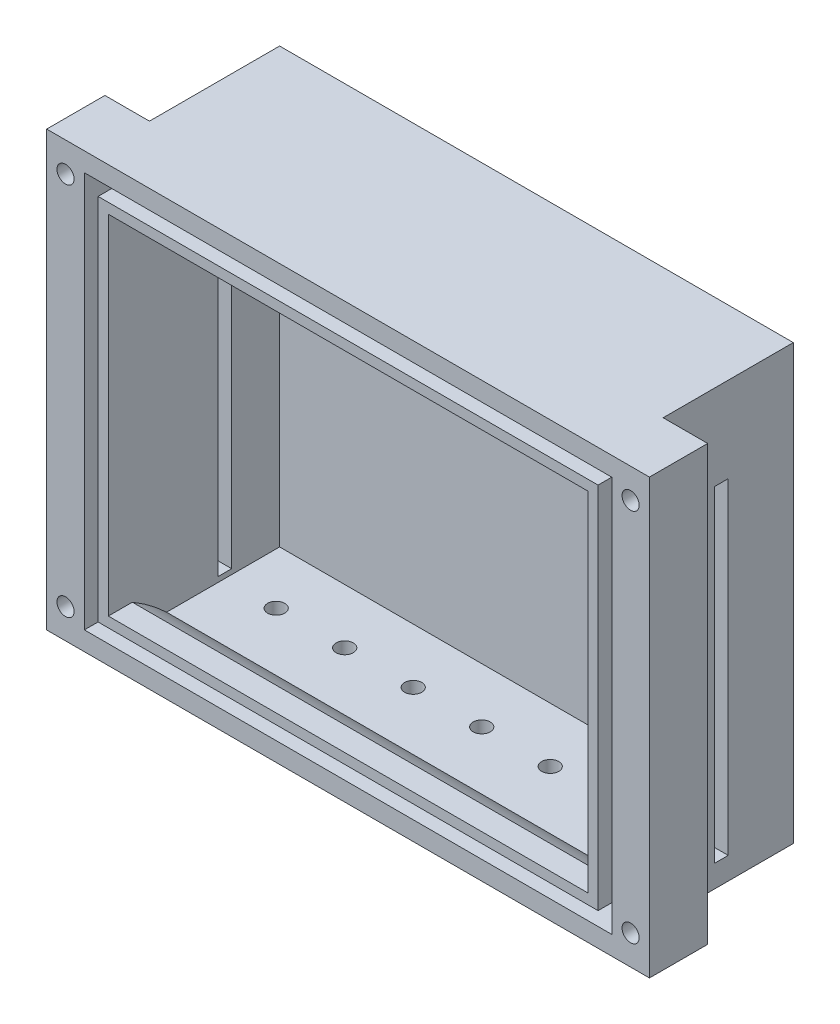
from build123d import *
from OCP.BRepFilletAPI import BRepFilletAPI_MakeChamfer

# Parameters (mm, degrees)
SKETCH1_R               = 172.5
BOSS_EXTRUDE1_DEPTH     = 10
SKETCH2_R               = 48.41
CUT_EXTRUDE1_DEPTH      = 10
BOSS_EXTRUDE2_DEPTH     = 5
CUT_EXTRUDE2_DEPTH      = 497
CUT_EXTRUDE6_START      = -497
CUT_EXTRUDE6_DEPTH      = 497
SKETCH6_W               = 195.767044214
SKETCH6_H               = 55
SKETCH6_W_2             = 185.767044214
SKETCH6_H_2             = 45
BOSS_EXTRUDE3_DEPTH     = 133.35
SKETCH7_W               = 185.767044214
SKETCH7_H               = 45
BOSS_EXTRUDE4_DEPTH     = 5
BOSS_EXTRUDE5_DEPTH     = 8
CHAMFER1_SIZE           = 8
CHAMFER1_SIZE2          = 6.250285012
CHAMFER1_PART_2_SIZE    = 8
CHAMFER1_PART_2_SIZE2   = 6.250285012
CHAMFER1_PART_3_SIZE    = 8
CHAMFER1_PART_3_SIZE2   = 6.250285012
FILLET1_R               = 38
SKETCH9_R               = 374.079334695
CUT_EXTRUDE7_DEPTH      = 93
CUT_EXTRUDE8_DEPTH      = 93
CUT_EXTRUDE8_DEPTH_BACK = 93
SKETCH10_R              = 229.38613092
SKETCH10_R_2            = 152.4
SKETCH11_W              = 291.443368419
SKETCH11_H              = 134.798764099
SKETCH11_W_2            = 144.967044214
SKETCH11_H_2            = 55
CUT_EXTRUDE9_DEPTH      = 143
SKETCH12_W              = 5
SKETCH12_H              = 55
BOSS_EXTRUDE6_DEPTH     = 133.35
SKETCH14_W              = 139.967044214
SKETCH14_H              = 45
BOSS_EXTRUDE7_DEPTH     = 5
SKETCH15_W              = 139.967044214
SKETCH15_H              = 123.35
CUT_EXTRUDE11_DEPTH     = 13
SKETCH16_W              = 10
SKETCH16_H              = 133.35
SKETCH16_W_2            = 149.967044214
BOSS_EXTRUDE9_DEPTH     = 17
SKETCH17_W              = 153.967044214
SKETCH17_H              = 115.6
SKETCH17_W_2            = 145.967044214
SKETCH17_H_2            = 107.6
CUT_EXTRUDE12_DEPTH     = 10
CHAMFER2_SIZE           = 10
CHAMFER2_SIZE2          = 5.773502692
SKETCH20_W              = 169.967044214
SKETCH20_H              = 3.35
CUT_EXTRUDE17_DEPTH     = 177.5
SKETCH25_W              = 139.967044214
SKETCH25_H              = 38.773502692
BOSS_EXTRUDE11_DEPTH    = 5
SKETCH26_W              = 3
SKETCH26_H              = 130
BOSS_EXTRUDE12_DEPTH    = 17
SKETCH18_R              = 2.5
CUT_EXTRUDE19_DEPTH     = 26
SKETCH27_W              = 60
SKETCH27_H              = 3
CUT_EXTRUDE20_DEPTH     = 23
SKETCH28_R              = 2.5
CUT_EXTRUDE21_DEPTH     = 10
SKETCH29_W              = 15
SKETCH29_H              = 30
BOSS_EXTRUDE13_DEPTH    = 10
SKETCH30_W              = 4
SKETCH30_H              = 23
CUT_EXTRUDE22_DEPTH     = 21
CHAMFER3_SIZE           = 6
SKETCH31_W              = 175.967044214
SKETCH31_H              = 24.006818343
CUT_EXTRUDE23_DEPTH     = 71
SKETCH33_W              = 4
SKETCH33_H              = 95.25
CUT_EXTRUDE25_DEPTH     = 182
CHAMFER5_SIZE           = 5
CHAMFER6_SIZE           = 4
FILLET2_R               = 10
SKETCH32_R              = 1.778
CUT_EXTRUDE26_DEPTH     = 10
CHAMFER7_SIZE           = 5
CHAMFER7_SIZE2          = 3.501037691
SKETCH34_W              = 3
SKETCH34_H              = 6.35
BOSS_EXTRUDE14_DEPTH    = 28.58
FILLET3_R               = 3
FILLET4_R               = 53
FILLET5_R               = 163
CHAMFER8_SIZE           = 2
CHAMFER8_SIZE2          = 2.856296013
FILLET7_R               = 10


# Some blends are built 0.0001 mm under size
with BuildPart() as part:
    # Sketch1 → Boss-Extrude1 (new body)
    with BuildSketch(Plane(origin=(0, 0, 0), x_dir=(1, 0, 0), z_dir=(0, 1, 0))):
        with Locations(Location((0, 0, 0), (0, 0, 270))):
            Circle(SKETCH1_R)
    extrude(amount=BOSS_EXTRUDE1_DEPTH)

    # Sketch2 → Cut-Extrude1 (cut)
    with BuildSketch(Plane(origin=(0, 10, 0), x_dir=(1, 0, 0), z_dir=(0, 1, 0))):
        with Locations((-75.91, -178.72)):
            Circle(SKETCH2_R)
        with Locations((75.91, -178.72)):
            Circle(SKETCH2_R)
    extrude(amount=-CUT_EXTRUDE1_DEPTH, mode=Mode.SUBTRACT)

    # Sketch3 → Boss-Extrude2 (add)
    with BuildSketch(Plane(origin=(0, 10, 0), x_dir=(1, 0, 0), z_dir=(0, 1, 0))):
        with BuildLine():
            Line((-98.968297449, -119.81), (98.968297449, -119.81))
            ThreePointArc((98.968297449, -119.81), (0, 155.4), (-98.968297449, -119.81))
        make_face()
        with BuildLine():
            ThreePointArc((97.883522107, -116.81), (0, 152.4), (-97.883522107, -116.81))
            Line((-97.883522107, -116.81), (97.883522107, -116.81))
        make_face(mode=Mode.SUBTRACT)
    extrude(amount=BOSS_EXTRUDE2_DEPTH)

    # Sketch4 → Cut-Extrude2 (cut)
    with BuildSketch(Plane(origin=(0, 10, 0), x_dir=(1, 0, 0), z_dir=(0, 1, 0))):
        Polygon((-28.261160255, -170.169200565), (28.261160255, -170.169200565), (28.261160255, -183.836149753), (-30.300470404, -183.836149753), align=None)
    extrude(amount=-CUT_EXTRUDE2_DEPTH, mode=Mode.SUBTRACT)

    # Sketch5 → Cut-Extrude6 (cut)
    with BuildSketch(Plane(origin=(0, 10, 0), x_dir=(1, 0, 0), z_dir=(0, 1, 0)).offset(CUT_EXTRUDE6_START)):
        with BuildLine():
            ThreePointArc((26.702080818, 170.420799435), (0, 172.5), (-26.702080818, 170.420799435))
            Line((-26.702080818, 170.420799435), (26.702080818, 170.420799435))
        make_face()
        with BuildLine():
            ThreePointArc((166.525, -45.007492432), (172.5, 0), (166.525, 45.007492432))
            Line((166.525, 45.007492432), (166.525, -45.007492432))
        make_face()
        with BuildLine():
            Line((-166.525, -45.007492432), (-166.525, 45.007492432))
            ThreePointArc((-166.525, 45.007492432), (-172.5, 0), (-166.525, -45.007492432))
        make_face()
    extrude(amount=CUT_EXTRUDE6_DEPTH, mode=Mode.SUBTRACT)

    # Sketch6 → Boss-Extrude3 (add)
    with BuildSketch(Plane(origin=(0, 10, 0), x_dir=(1, 0, 0), z_dir=(0, 1, 0))):
        with Locations((0, -89.31)):
            Rectangle(SKETCH6_W, SKETCH6_H)
        with Locations((0, -89.31)):
            Rectangle(SKETCH6_W_2, SKETCH6_H_2, mode=Mode.SUBTRACT)
    extrude(amount=BOSS_EXTRUDE3_DEPTH)

    # Sketch7 → Boss-Extrude4 (add)
    with BuildSketch(Plane(origin=(0, 10, 0), x_dir=(1, 0, 0), z_dir=(0, 1, 0))):
        with Locations((0, -89.31)):
            Rectangle(SKETCH7_W, SKETCH7_H)
    extrude(amount=BOSS_EXTRUDE4_DEPTH)

    # Sketch8 → Boss-Extrude5 (add)
    with BuildSketch(Plane(origin=(0, 10, 0), x_dir=(1, 0, 0), z_dir=(0, 1, 0))):
        with BuildLine():
            Line((-97.883522107, -61.81), (-112.883522107, -61.81))
            Line((-112.883522107, -61.81), (-112.883522107, -101.267136509))
            ThreePointArc((-112.883522107, -101.267136509), (-105.634768892, -108.807252061), (-97.883522107, -115.829782871))
            Line((-97.883522107, -115.829782871), (-97.883522107, -61.81))
        make_face()
        with BuildLine():
            Line((-88.028513968, -46.81), (-88.028513968, -61.81))
            Line((-88.028513968, -61.81), (97.883522107, -61.81))
            Line((97.883522107, -61.81), (97.883522107, -115.829782871))
            ThreePointArc((97.883522107, -115.829782871), (105.634768892, -108.807252061), (112.883522107, -101.267136509))
            Line((112.883522107, -101.267136509), (112.883522107, -46.81))
            Line((112.883522107, -46.81), (-88.028513968, -46.81))
        make_face()
    extrude(amount=BOSS_EXTRUDE5_DEPTH)

    # Chamfer1
    chamfer1_edges = [part.edges().sort_by_distance(p)[0] for p in [
        (-97.883522107, 18, 88.819891436),
    ]]
    chamfer1_side = [part.faces().sort_by_distance(p)[0] for p in [
        (-97.883522107, 80.599247918, 89.340686997),
    ]]
    chamfer(chamfer1_edges, length=CHAMFER1_SIZE, length2=CHAMFER1_SIZE2, reference=chamfer1_side[0])

    # Chamfer1 part 2
    chamfer1_part_2_edges = [part.edges().sort_by_distance(p)[0] for p in [
        (4.927504069, 18, 61.81),
    ]]
    chamfer1_part_2_side = [part.faces().sort_by_distance(p)[0] for p in [
        (-0.807441513, 80.139082253, 61.81),
    ]]
    chamfer(chamfer1_part_2_edges, length=CHAMFER1_PART_2_SIZE, length2=CHAMFER1_PART_2_SIZE2, reference=chamfer1_part_2_side[0])

    # Chamfer1 part 3
    chamfer1_part_3_edges = [part.edges().sort_by_distance(p)[0] for p in [
        (97.883522107, 18, 88.819891436),
    ]]
    chamfer1_part_3_side = [part.faces().sort_by_distance(p)[0] for p in [
        (97.883522107, 80.599247918, 89.340686997),
    ]]
    chamfer(chamfer1_part_3_edges, length=CHAMFER1_PART_3_SIZE, length2=CHAMFER1_PART_3_SIZE2, reference=chamfer1_part_3_side[0])

    # Fillet1
    # the kernel refuses this fillet: 38 mm, written as the material it adds along each edge
    with BuildSketch(Plane(origin=(-97.883522107, 26, 148.028657271), x_dir=(-0.61566147532566, -0.7880107536067207, 0), z_dir=(0, 0, -1))) as fillet1_piece_1_section:
        with BuildLine():
            CenterArc((13.24591235, 37.873851244), FILLET1_R, 232, 33.330100487)
            Line((-10.149223713, 7.929442607), (0, 0))
            Line((0, 0), (10.152145721, 0))
        make_face()
    fillet1_piece_1 = extrude(amount=86.218657271, mode=Mode.PRIVATE)
    fillet1_piece_1 = fillet1_piece_1 & Plane(origin=(0, 26, 0), x_dir=(-0.7443687577094257, 0, 0.6677687867414337), z_dir=(0, -1, 0)) * Cylinder(151.65, 214, mode=Mode.PRIVATE)
    add(fillet1_piece_1)
    with BuildSketch(Plane(origin=(-88.028513968, 26, 61.81), x_dir=(0, 1, 0), z_dir=(1, 0, 0))) as fillet1_piece_2_section:
        with BuildLine():
            CenterArc((12.87954976, -38), FILLET1_R, 90, 33.330100487)
            Line((-8, -6.250285012), (0, 0))
            Line((0, 0), (12.87954976, 0))
        make_face()
    fillet1_piece_2 = extrude(amount=218.110910475, mode=Mode.PRIVATE)
    fillet1_piece_2 = fillet1_piece_2 - Plane(origin=(135.883522107, 38.87954976, 61.81), x_dir=(-0.8355188154722692, -0.5494618357919104, 0), z_dir=(0, 0, -1)) * Cylinder(38, 488, mode=Mode.PRIVATE)
    add(fillet1_piece_2)
    with BuildSketch(Plane(origin=(97.883522107, 26, 29.6111256), x_dir=(0.61566147532566, -0.7880107536067207, 0), z_dir=(0, 0, 1))) as fillet1_piece_3_section:
        with BuildLine():
            CenterArc((13.24591235, 37.873851244), FILLET1_R, 232, 33.330100487)
            Line((-10.149223713, 7.929442607), (0, 0))
            Line((0, 0), (10.152145721, 0))
        make_face()
    fillet1_piece_3 = extrude(amount=118.417531672, mode=Mode.PRIVATE)
    fillet1_piece_3 = fillet1_piece_3 & Plane(origin=(0, 26, 0), x_dir=(0.6454567893612635, 0, 0.7637967878090673), z_dir=(0, -1, 0)) * Cylinder(151.65, 278, mode=Mode.PRIVATE)
    fillet1_piece_3 = fillet1_piece_3 - Plane(origin=(97.883522107, 38.87954976, 23.81), x_dir=(0, 0, 1), z_dir=(-1, 0, 0)) * Cylinder(38, 278, mode=Mode.PRIVATE)
    add(fillet1_piece_3)

    # Sketch9 → Cut-Extrude7 (cut)
    with BuildSketch(Plane(origin=(0, 10, 0), x_dir=(1, 0, 0), z_dir=(0, 1, 0))):
        Circle(SKETCH9_R)
    extrude(amount=-CUT_EXTRUDE7_DEPTH, mode=Mode.SUBTRACT)

    # Sketch10 → Cut-Extrude8 (cut, two sides: drawn at the far end of the back side and taken through both)
    with BuildSketch(Plane.XZ.offset(-10).offset(-CUT_EXTRUDE8_DEPTH_BACK)):
        Circle(SKETCH10_R)
        Circle(SKETCH10_R_2, mode=Mode.SUBTRACT)
    extrude(amount=CUT_EXTRUDE8_DEPTH + CUT_EXTRUDE8_DEPTH_BACK, mode=Mode.SUBTRACT)

    # Sketch11 → Cut-Extrude9 (cut)
    with BuildSketch(Plane(origin=(0, 143.35, 0), x_dir=(1, 0, 0), z_dir=(0, 1, 0))):
        with Locations((4.840839595, -88.771460056)):
            Rectangle(SKETCH11_W, SKETCH11_H)
        with Locations((-25.4, -89.31)):
            Rectangle(SKETCH11_W_2, SKETCH11_H_2, mode=Mode.SUBTRACT)
    extrude(amount=-CUT_EXTRUDE9_DEPTH, mode=Mode.SUBTRACT)

    # Sketch12 → Boss-Extrude6 (add)
    with BuildSketch(Plane(origin=(0, 143.35, 0), x_dir=(1, 0, 0), z_dir=(0, 1, 0))):
        with Locations((49.583522107, -89.31)):
            Rectangle(SKETCH12_W, SKETCH12_H)
    extrude(amount=-BOSS_EXTRUDE6_DEPTH)

    # Sketch14 → Boss-Extrude7 (add)
    with BuildSketch(Plane(origin=(0, 143.35, 0), x_dir=(1, 0, 0), z_dir=(0, 1, 0))):
        with Locations((-22.9, -89.31)):
            Rectangle(SKETCH14_W, SKETCH14_H)
    extrude(amount=-BOSS_EXTRUDE7_DEPTH)

    # Sketch15 → Cut-Extrude11 (cut)
    with BuildSketch(Plane.XY.offset(116.81)):
        with Locations((-22.9, 76.675)):
            Rectangle(SKETCH15_W, SKETCH15_H)
    extrude(amount=-CUT_EXTRUDE11_DEPTH, mode=Mode.SUBTRACT)

    # Sketch16 → Boss-Extrude9 (add)
    # profile 1 of 5: a face of its own
    with BuildSketch(Plane.XY.offset(116.81)):
        with Locations((-102.883522107, 76.675)):
            Rectangle(SKETCH16_W, SKETCH16_H)
    # profile 2 of 5: a face of its own
    with BuildSketch(Plane.XY.offset(116.81)):
        with Locations((-22.9, 76.675)):
            Rectangle(SKETCH16_W_2, SKETCH16_H)
        Polygon((-92.883522107, 127.475), (-92.883522107, 138.35), (47.083522107, 138.35), (47.083522107, 127.475), (47.083522107, 76.675), (47.083522107, 25.875), (47.083522107, 15), (-92.883522107, 15), (-92.883522107, 25.875), (-92.883522107, 76.675), align=None, mode=Mode.SUBTRACT)
    # profile 3 of 5: a face of its own
    with BuildSketch(Plane.XY.offset(116.81)):
        with Locations((57.083522107, 76.675)):
            Rectangle(SKETCH16_W, SKETCH16_H)
    # profile 4 of 5: a face of its own
    with BuildSketch(Plane.XY.offset(116.81)):
        Polygon((47.083522107, 138.35), (-92.883522107, 138.35), (-92.883522107, 127.475), (-22.9, 127.475), (47.083522107, 127.475), align=None)
    # profile 5 of 5: a face of its own
    with BuildSketch(Plane.XY.offset(116.81)):
        Polygon((-22.9, 25.875), (-92.883522107, 25.875), (-92.883522107, 15), (47.083522107, 15), (47.083522107, 25.875), align=None)
    extrude(amount=-BOSS_EXTRUDE9_DEPTH)

    # Sketch17 → Cut-Extrude12 (cut)
    with BuildSketch(Plane.XY.offset(116.81)):
        with Locations((-22.9, 76.675)):
            Rectangle(SKETCH17_W, SKETCH17_H)
        with Locations((-22.9, 76.675)):
            Rectangle(SKETCH17_W_2, SKETCH17_H_2, mode=Mode.SUBTRACT)
    extrude(amount=-CUT_EXTRUDE12_DEPTH, mode=Mode.SUBTRACT)

    # Chamfer2: one chamfer whose edges measure the first distance from different faces: ONE call of the kernel's chamfer builder (chamfer() names one face for all edges)
    chamfer2_edges_1 = [part.edges().sort_by_distance(p)[0] for p in [
        (-22.9, 25.875, 99.81),
    ]]
    chamfer2_side_1 = [part.faces().sort_by_distance(p)[0] for p in [
        (-22.9, 25.875, 108.31),
    ]]
    chamfer2_edges_2 = [part.edges().sort_by_distance(p)[0] for p in [
        (-22.9, 127.475, 99.81),
    ]]
    chamfer2_side_2 = [part.faces().sort_by_distance(p)[0] for p in [
        (-22.9, 132.9125, 99.81),
    ]]
    chamfer2 = BRepFilletAPI_MakeChamfer(part.part.solid().wrapped)
    for e in chamfer2_edges_1:
        chamfer2.Add(CHAMFER2_SIZE, CHAMFER2_SIZE2, e.wrapped, chamfer2_side_1[0].wrapped)  # the first distance lies on this face
    for e in chamfer2_edges_2:
        chamfer2.Add(CHAMFER2_SIZE, CHAMFER2_SIZE2, e.wrapped, chamfer2_side_2[0].wrapped)  # the first distance lies on this face
    add(Compound.cast(chamfer2.Shape()), mode=Mode.REPLACE)

    # Sketch20 → Cut-Extrude17 (cut)
    with BuildSketch(Plane.XY.offset(116.81)):
        with Locations((-22.9, 11.675)):
            Rectangle(SKETCH20_W, SKETCH20_H)
    extrude(amount=-CUT_EXTRUDE17_DEPTH, mode=Mode.SUBTRACT)

    # Sketch25 → Boss-Extrude11 (add)
    with BuildSketch(Plane(origin=(0, 13.35, 0), x_dir=(-1, 0, 0), z_dir=(0, -1, 0))):
        with Locations((22.9, -86.196751346)):
            Rectangle(SKETCH25_W, SKETCH25_H)
    extrude(amount=-BOSS_EXTRUDE11_DEPTH)

    # Sketch26 → Boss-Extrude12 (add)
    with BuildSketch(Plane.XY.offset(116.81)):
        with Locations((-109.383522107, 78.35)):
            Rectangle(SKETCH26_W, SKETCH26_H)
        with Locations((63.583522107, 78.35)):
            Rectangle(SKETCH26_W, SKETCH26_H)
    extrude(amount=-BOSS_EXTRUDE12_DEPTH)

    # Sketch18 → Cut-Extrude19 (cut)
    with BuildSketch(Plane.XY.offset(116.81)):
        with Locations((-105.383522107, 22)):
            Circle(SKETCH18_R)
        with Locations((59.583522107, 22)):
            Circle(SKETCH18_R)
        with Locations((59.583522107, 131.35)):
            Circle(SKETCH18_R)
        with Locations((-105.383522107, 131.35)):
            Circle(SKETCH18_R)
    extrude(amount=-CUT_EXTRUDE19_DEPTH, mode=Mode.SUBTRACT)

    # Sketch27 → Cut-Extrude20 (cut)
    with BuildSketch(Plane.XY.offset(66.81)):
        with Locations((7.083522107, 136.85)):
            Rectangle(SKETCH27_W, SKETCH27_H)
    extrude(amount=-CUT_EXTRUDE20_DEPTH, mode=Mode.SUBTRACT)

    # Sketch28 → Cut-Extrude21 (cut)
    with BuildSketch(Plane(origin=(0, 18.35, 0), x_dir=(1, 0, 0), z_dir=(0, 1, 0))):
        with Locations(Location((-77.883522107, -82.81, 0), (0, 0, 270))):
            Circle(SKETCH28_R)
        with Locations(Location((-57.883522107, -82.81, 0), (0, 0, 270))):
            Circle(SKETCH28_R)
        with Locations(Location((-37.883522107, -82.81, 0), (0, 0, 270))):
            Circle(SKETCH28_R)
        with Locations(Location((-17.883522107, -82.81, 0), (0, 0, 270))):
            Circle(SKETCH28_R)
        with Locations(Location((2.116477893, -82.81, 0), (0, 0, 270))):
            Circle(SKETCH28_R)
        with Locations(Location((22.116477893, -82.81, 0), (0, 0, 270))):
            Circle(SKETCH28_R)
    extrude(amount=-CUT_EXTRUDE21_DEPTH, mode=Mode.SUBTRACT)

    # Sketch29 → Boss-Extrude13 (add)
    with BuildSketch(Plane(origin=(0, 0, 61.81), x_dir=(-1, 0, 0), z_dir=(0, 0, -1))):
        with Locations((47.190948631, 83.35)):
            Rectangle(SKETCH29_W, SKETCH29_H)
    extrude(amount=BOSS_EXTRUDE13_DEPTH)

    # Sketch30 → Cut-Extrude22 (cut)
    with BuildSketch(Plane.ZY.offset(54.690948631)):
        with Locations((59.81, 83.35)):
            Rectangle(SKETCH30_W, SKETCH30_H)
    extrude(amount=-CUT_EXTRUDE22_DEPTH, mode=Mode.SUBTRACT)

    # Chamfer3
    chamfer3_edges = [part.edges().sort_by_distance(p)[0] for p in [
        (-47.190948631, 68.35, 61.81),
        (-47.190948631, 98.35, 61.81),
    ]]
    chamfer(chamfer3_edges, length=CHAMFER3_SIZE)

    # Sketch31 → Cut-Extrude23 (cut)
    with BuildSketch(Plane.XY.offset(116.81)):
        with Locations((-22.9, 1.346590829)):
            Rectangle(SKETCH31_W, SKETCH31_H)
        with Locations((-22.9, 152.003409172)):
            Rectangle(SKETCH31_W, SKETCH31_H)
    extrude(amount=-CUT_EXTRUDE23_DEPTH, mode=Mode.SUBTRACT)

    # Sketch33 → Cut-Extrude25 (cut)
    with BuildSketch(Plane.ZY.offset(97.883522107)):
        with Locations((82.81, 67.475)):
            Rectangle(SKETCH33_W, SKETCH33_H)
    extrude(amount=-CUT_EXTRUDE25_DEPTH, mode=Mode.SUBTRACT)

    # Chamfer5
    chamfer5_edges = [part.edges().sort_by_distance(p)[0] for p in [
        (-39.690948631, 83.35, 51.81),
        (-54.690948631, 83.35, 51.81),
    ]]
    chamfer(chamfer5_edges, length=CHAMFER5_SIZE)

    # Chamfer6
    chamfer6_edges = [part.edges().sort_by_distance(p)[0] for p in [
        (-47.190948631, 98.35, 51.81),
        (-47.190948631, 68.35, 51.81),
    ]]
    chamfer(chamfer6_edges, length=CHAMFER6_SIZE - 0.0001)  # a hair under: the kernel refuses the full size

    # Fillet2
    # the kernel refuses this fillet: 10 mm, written as the material it takes off along each edge
    with BuildSketch(Plane(origin=(-49.690948631, 104.705439059, 51.81), x_dir=(-0.7071067811865475, 0, 0.7071067811865475), z_dir=(0, -1, 0))) as fillet2_piece_1:
        with BuildLine():
            CenterArc((FILLET2_R * 0.414213562373, -FILLET2_R), FILLET2_R, 90, 45)
            Line((-FILLET2_R * 0.292893218813, -FILLET2_R * 0.292893218813), (0, 0))
            Line((0, 0), (FILLET2_R * 0.414213562373, 0))
        make_face()
    extrude(amount=42.710878119, mode=Mode.SUBTRACT)
    with BuildSketch(Plane(origin=(-44.690948631, 61.994560941, 51.81), x_dir=(-1, 0, 0), z_dir=(0, 1, 0))) as fillet2_piece_2:
        with BuildLine():
            CenterArc((FILLET2_R * 0.414213562373, FILLET2_R), FILLET2_R, 225, 45)
            Line((-FILLET2_R * 0.292893218813, FILLET2_R * 0.292893218813), (0, 0))
            Line((0, 0), (FILLET2_R * 0.414213562373, 0))
        make_face()
    extrude(amount=42.710878119, mode=Mode.SUBTRACT)

    # Sketch32 → Cut-Extrude26 (cut)
    with BuildSketch(Plane.XY.offset(66.81)):
        with Locations((-60.006477893, 103.09)):
            Circle(SKETCH32_R)
        with Locations((5.083522107, 30.7)):
            Circle(SKETCH32_R)
    extrude(amount=-CUT_EXTRUDE26_DEPTH, mode=Mode.SUBTRACT)

    # Chamfer7
    chamfer7_edges = [part.edges().sort_by_distance(p)[0] for p in [
        (-39.690948631, 99.6, 61.81),
        (-54.690948631, 67.1, 61.81),
        (-39.690948631, 67.1, 61.81),
    ]]
    chamfer7_side = [part.faces().sort_by_distance(p)[0] for p in [
        (-22.812662078, 75.997492885, 61.81),
    ]]
    chamfer(chamfer7_edges, length=CHAMFER7_SIZE, length2=CHAMFER7_SIZE2, reference=chamfer7_side[0])

    # Sketch34 → Boss-Extrude14 (add)
    with BuildSketch(Plane.ZY.offset(-47.083522107)):
        with Locations((73.07, 21.525)):
            Rectangle(SKETCH34_W, SKETCH34_H)
    extrude(amount=BOSS_EXTRUDE14_DEPTH)

    # Fillet3
    fillet3_edges = [part.edges().sort_by_distance(p)[0] for p in [
        (18.503522107, 24.7, 73.07),
    ]]
    fillet(fillet3_edges, radius=FILLET3_R)

    # Fillet4
    # the kernel refuses this fillet: 53 mm, written as the material it takes off along each edge
    with BuildSketch(Plane(origin=(47.083522107, 20.101497308, 99.81), x_dir=(0, 0.5000000000000011, 0.866025403784438), z_dir=(-1, 0, 0))) as fillet4_piece_1:
        with BuildLine():
            CenterArc((11.713308348, -53), FILLET4_R, 90, 13.740767961)
            Line((-0.875748654, -1.516841163), (0, 0))
            Line((0, 0), (11.713308348, 0))
        make_face()
    extrude(amount=139.967044213, mode=Mode.SUBTRACT)

    # Fillet5
    # the kernel refuses this fillet: 163 mm, written as the material it takes off along each edge
    with BuildSketch(Plane(origin=(-92.883522107, 137.475, 99.81), x_dir=(0, 1, 0), z_dir=(1, 0, 0))) as fillet5_piece_1:
        with BuildLine():
            CenterArc((71.820622524, 146.750532008), FILLET5_R, 240, 4.198846939)
            Line((-9.679377476, 5.588391191), (0, 0))
            Line((0, 0), (0.875, 0))
        make_face()
    extrude(amount=139.967044213, mode=Mode.SUBTRACT)

    # Chamfer8
    chamfer8_edges = [part.edges().sort_by_distance(p)[0] for p in [
        (7.083522107, 135.35, 66.81),
    ]]
    chamfer8_side = [part.faces().sort_by_distance(p)[0] for p in [
        (-23.219737969, 77.729226507, 66.81),
    ]]
    chamfer(chamfer8_edges, length=CHAMFER8_SIZE, length2=CHAMFER8_SIZE2, reference=chamfer8_side[0])

    # Fillet7
    # the kernel refuses this fillet: 10 mm, written as the material it takes off along each edge
    with BuildSketch(Plane(origin=(37.083522107, 135.35, 63.953703987), x_dir=(0, 0, -1), z_dir=(-1, 0, 0))) as fillet7_piece_1:
        with BuildLine():
            CenterArc((3.238895476, 9.93984686), FILLET7_R, 235, 28.712402638)
            Line((-2.496868888, 1.748326417), (-2.611584175, 1.584496008))
            Line((-2.611584175, 1.584496008), (-0.114715287, -0.163830409))
            Line((-0.114715287, -0.163830409), (0, -0.2))
            ThreePointArc((0, -0.2), (1.071851993, -0.2), (2.121800157, -0.198796937))
            Line((2.121800157, -0.198796937), (2.143703987, 0))
        make_face()
    extrude(amount=60, mode=Mode.SUBTRACT)


solid = part.part
